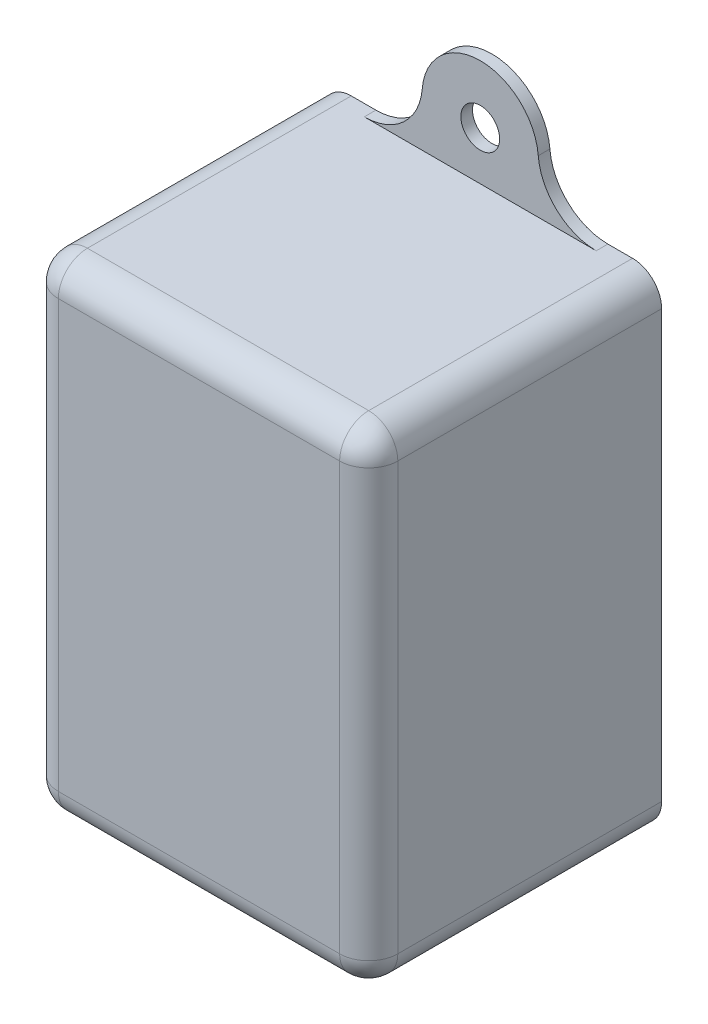
from build123d import *

# Parameters (mm, degrees)
SKETCH_1_R      = 2
EXTRUDE_1_DEPTH = 1.2
SKETCH_5_W      = 35
SKETCH_5_H      = 50
EXTRUDE_2_DEPTH = 29
FILLET_1_R      = 3


with BuildPart() as part:
    # 草图1 → 拉伸1 (new body)
    with BuildSketch(Plane.XY):
        with BuildLine():
            Line((-11.958260743, 25), (-17.5, 25))
            Line((-17.5, 25), (-17.5, -25))
            Line((-17.5, -25), (-11.958260743, -25))
            ThreePointArc((-11.958260743, -25), (-7.896241541, -26.584119567), (-5.979130372, -30.5))
            ThreePointArc((-5.979130372, -30.5), (0, -36), (5.979130372, -30.5))
            ThreePointArc((5.979130372, -30.5), (7.896241541, -26.584119567), (11.958260743, -25))
            Line((11.958260743, -25), (17.5, -25))
            Line((17.5, -25), (17.5, 25))
            Line((17.5, 25), (11.958260743, 25))
            ThreePointArc((11.958260743, 25), (7.896241541, 26.584119567), (5.979130372, 30.5))
            ThreePointArc((5.979130372, 30.5), (0, 36), (-5.979130372, 30.5))
            ThreePointArc((-5.979130372, 30.5), (-7.896241541, 26.584119567), (-11.958260743, 25))
        make_face()
        with Locations((0, 30)):
            Circle(SKETCH_1_R, mode=Mode.SUBTRACT)
        with Locations((0, -30)):
            Circle(SKETCH_1_R, mode=Mode.SUBTRACT)
    extrude(amount=EXTRUDE_1_DEPTH)

    # 草图5 → 拉伸2 (add)
    with BuildSketch(Plane.XY.offset(1.2)):
        Rectangle(SKETCH_5_W, SKETCH_5_H)
    extrude(amount=EXTRUDE_2_DEPTH)

    # 圆角1
    fillet_1_edges = [part.edges().sort_by_distance(p)[0] for p in [
        (0, 25, 30.2),
        (17.5, 0, 30.2),
        (0, -25, 30.2),
        (-17.5, 0, 30.2),
        (-17.5, 25, 15.1),
        (-17.5, -25, 15.1),
        (17.5, -25, 15.1),
        (17.5, 25, 15.1),
    ]]
    fillet(fillet_1_edges, radius=FILLET_1_R)


solid = part.part
